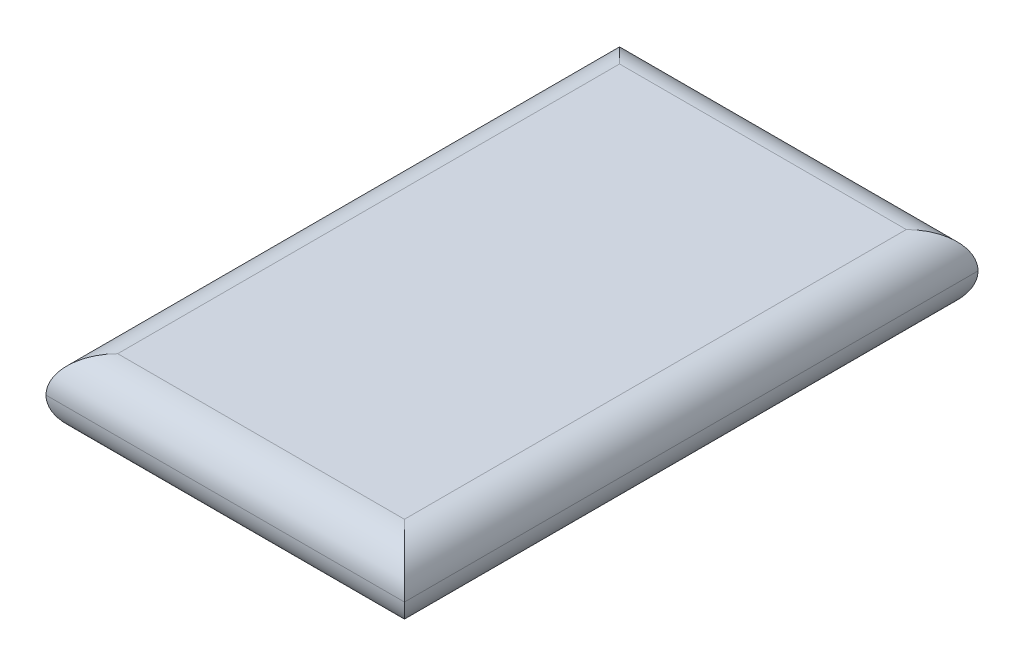
from build123d import *

# Parameters (mm, degrees)
SKETCH2_W           = 40.64
SKETCH2_H           = 5.08
BOSS_EXTRUDE1_DEPTH = 25.4
FILLET1_R           = 2.54


with BuildPart() as part:
    # Sketch2 → Boss-Extrude1 (new body)
    with BuildSketch(Plane(origin=(0, 0, 0), x_dir=(0, 0, -1), z_dir=(1, 0, 0))):
        Rectangle(SKETCH2_W, SKETCH2_H)
    extrude(amount=BOSS_EXTRUDE1_DEPTH)

    # Fillet1
    fillet1_edges = [part.edges().sort_by_distance(p)[0] for p in [
        (12.7, -2.54, 20.32),
        (25.4, -2.54, 0),
        (12.7, -2.54, -20.32),
        (0, -2.54, 0),
        (12.7, 2.54, -20.32),
        (25.4, 2.54, 0),
        (12.7, 2.54, 20.32),
        (0, 2.54, 0),
    ]]
    fillet(fillet1_edges, radius=FILLET1_R - 0.0001)  # a hair under: the kernel refuses the full size


solid = part.part
